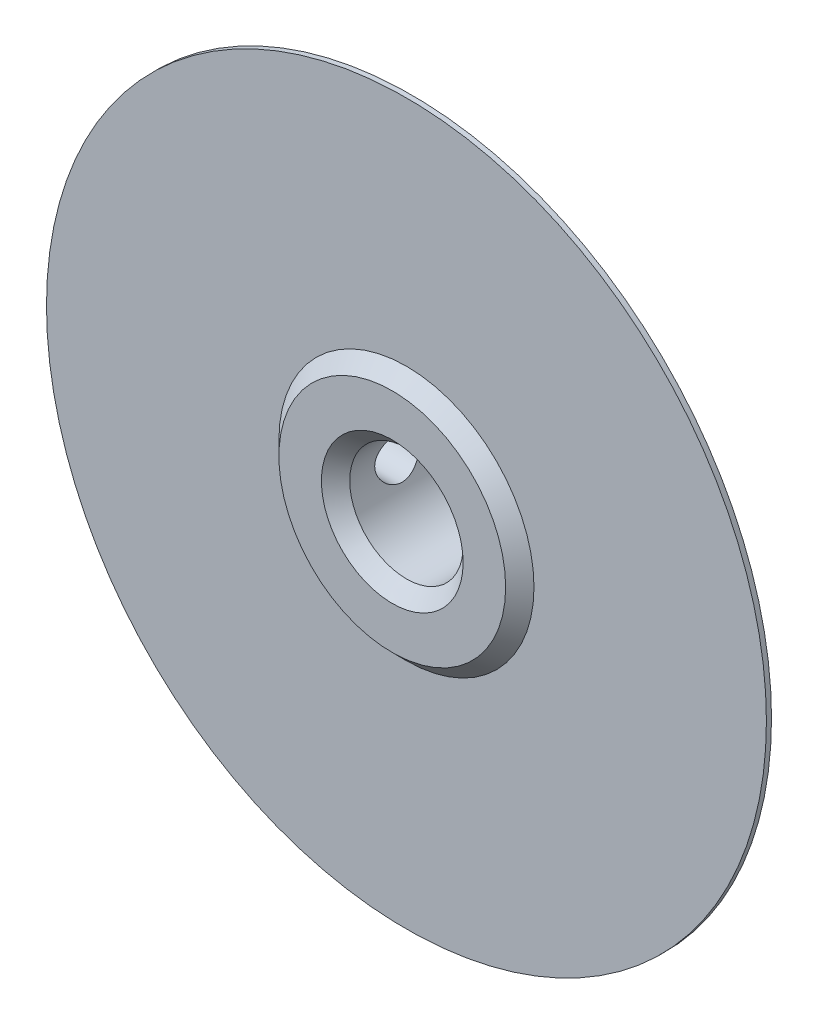
from build123d import *

# Parameters (mm, degrees)
SKETCH_1_R          = 12.7
SKETCH_1_R_2        = 2
EXTRUDE_1_DEPTH     = 0.18
EXTRUDE_START       = 3
SKETCH_2_R          = 3.6
SKETCH_2_R_2        = 2
EXTRUDE_2_DEPTH     = 3
SKETCH_3_R          = 0.8
CUT_EXTRUDE_1_DEPTH = 10
CHAMFER_1_SIZE      = 0.5
SKETCH_4_R          = 4.5
SKETCH_4_R_2        = 2
EXTRUDE_3_DEPTH     = 0.5
CHAMFER_2_SIZE      = 0.5
CHAMFER_3_SIZE      = 0.5


with BuildPart() as part:
    # 草图1 → 凸台-拉伸1 (new body)
    with BuildSketch(Plane.XY):
        with Locations(Location((0, 0, 0), (0, 0, 180))):
            Circle(SKETCH_1_R)
        with Locations(Location((0, 0, 0), (0, 0, 180))):
            Circle(SKETCH_1_R_2, mode=Mode.SUBTRACT)
    extrude(amount=EXTRUDE_1_DEPTH)

    # 草图2 → 凸台-拉伸2 (add)
    with BuildSketch(Plane(origin=(0, 0, 0), x_dir=(-1, 0, 0), z_dir=(0, 0, -1)).offset(EXTRUDE_START)):
        with Locations(Location((0, 0, 0), (0, 0, 180))):
            Circle(SKETCH_2_R)
        Circle(SKETCH_2_R_2, mode=Mode.SUBTRACT)
    extrude(amount=-EXTRUDE_2_DEPTH)

    # 草图3 → 切除-拉伸1 (cut)
    with BuildSketch(Plane(origin=(0, 0, 0), x_dir=(0, 0, -1), z_dir=(1, 0, 0))):
        with Locations((1.5, 0)):
            Circle(SKETCH_3_R)
    extrude(amount=-CUT_EXTRUDE_1_DEPTH, mode=Mode.SUBTRACT)

    # 倒角1
    chamfer_1_edges = [part.edges().sort_by_distance(p)[0] for p in [
        (-3.6, 0, -3),
        (2, 0, -3),
    ]]
    chamfer(chamfer_1_edges, length=CHAMFER_1_SIZE)

    # 草图4 → 凸台-拉伸3 (add)
    with BuildSketch(Plane.XY.offset(0.18)):
        Circle(SKETCH_4_R)
        with Locations(Location((0, 0, 0), (0, 0, 180))):
            Circle(SKETCH_4_R_2, mode=Mode.SUBTRACT)
    extrude(amount=EXTRUDE_3_DEPTH)

    # 倒角2
    chamfer_2_edges = [part.edges().sort_by_distance(p)[0] for p in [
        (-4.5, 0, 0.68),
    ]]
    chamfer(chamfer_2_edges, length=CHAMFER_2_SIZE - 0.0001)  # a hair under: the kernel refuses the full size

    # 倒角3
    chamfer_3_edges = [part.edges().sort_by_distance(p)[0] for p in [
        (2, 0, 0.68),
    ]]
    chamfer(chamfer_3_edges, length=CHAMFER_3_SIZE)


solid = part.part
